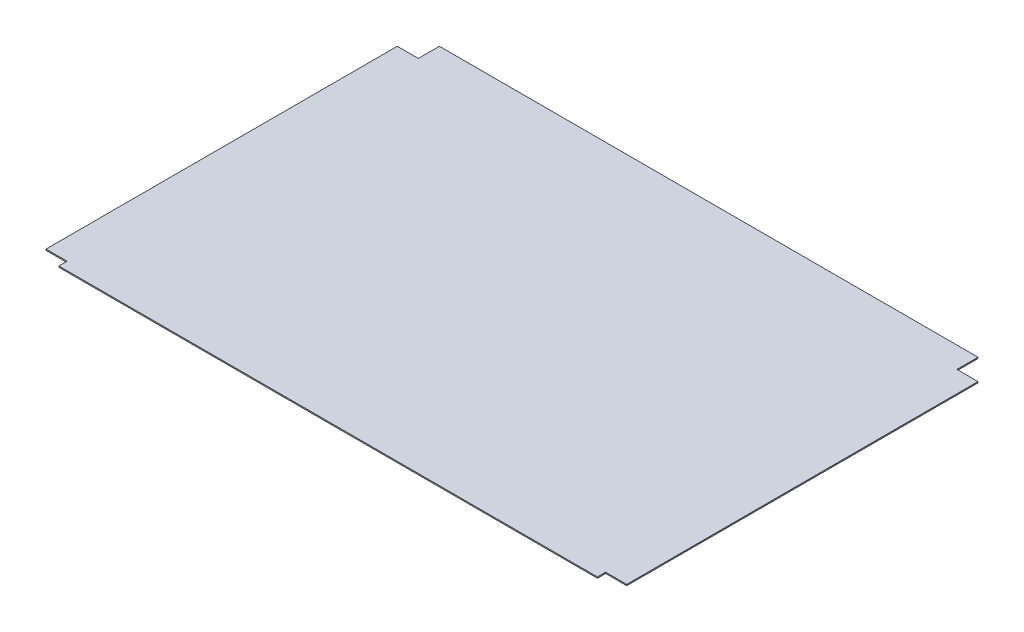
from build123d import *

# Parameters (mm, degrees)
SKETCH1_W               = 629.92
SKETCH1_H               = 426.72
EXTRUDE1_DEPTH          = 1.27
SKETCH2_W               = 22.86
SKETCH2_H               = 22.86
EXTRUDE2_DEPTH          = 381.425950876
MIRROR2_COPY_1_SKETCH_W = 22.86
MIRROR2_COPY_1_SKETCH_H = 22.86
MIRROR2_COPY_1_DEPTH    = 381.425950876
MIRROR2_COPY_2_SKETCH_W = 22.86
MIRROR2_COPY_2_SKETCH_H = 22.86
MIRROR2_COPY_2_DEPTH    = 381.425950876
SKETCH3_W               = 584.2
SKETCH3_H               = 1.27
EXTRUDE3_DEPTH          = 13.97


with BuildPart() as part:
    # Sketch1 → Extrude1 (new body)
    with BuildSketch(Plane(origin=(0, 0, 0), x_dir=(1, 0, 0), z_dir=(0, 1, 0))):
        Rectangle(SKETCH1_W, SKETCH1_H)
    extrude(amount=EXTRUDE1_DEPTH)

    # Sketch2 → Extrude2 (cut, through all)
    with BuildSketch(Plane(origin=(0, 1.27, 0), x_dir=(1, 0, 0), z_dir=(0, 1, 0))):
        with Locations((-303.53, -201.93)):
            Rectangle(SKETCH2_W, SKETCH2_H)
    extrude2 = extrude(amount=-EXTRUDE2_DEPTH, mode=Mode.SUBTRACT)

    # Mirror1: Extrude2 across plane
    add(extrude2.mirror(Plane(origin=(0, 0, 0), x_dir=(0, 0, 1), z_dir=(1, 0, 0))), mode=Mode.SUBTRACT)

    # Mirror2 copy 1 sketch → Mirror2 copy 1 (cut, through all)
    with BuildSketch(Plane(origin=(0, 1.27, 0), x_dir=(-1, 0, 0), z_dir=(0, 1, 0))):
        with Locations((-303.53, -201.93)):
            Rectangle(MIRROR2_COPY_1_SKETCH_W, MIRROR2_COPY_1_SKETCH_H)
    extrude(amount=-MIRROR2_COPY_1_DEPTH, mode=Mode.SUBTRACT)

    # Mirror2 copy 2 sketch → Mirror2 copy 2 (cut, through all)
    with BuildSketch(Plane(origin=(0, 1.27, 0), x_dir=(1, 0, 0), z_dir=(0, 1, 0))):
        with Locations((-303.53, 201.93)):
            Rectangle(MIRROR2_COPY_2_SKETCH_W, MIRROR2_COPY_2_SKETCH_H)
    extrude(amount=-MIRROR2_COPY_2_DEPTH, mode=Mode.SUBTRACT)

    # Sketch3 → Extrude3 (cut)
    with BuildSketch(Plane.XY.offset(213.36)):
        with Locations((0, 0.635)):
            Rectangle(SKETCH3_W, SKETCH3_H)
    extrude(amount=-EXTRUDE3_DEPTH, mode=Mode.SUBTRACT)


solid = part.part
